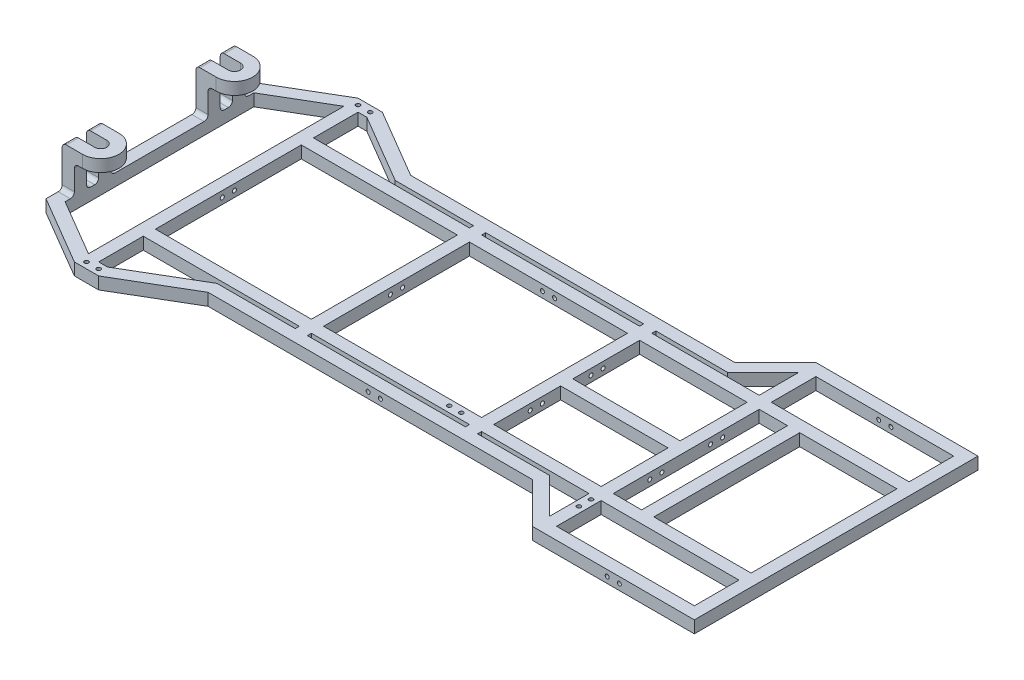
from build123d import *

# Parameters (mm, degrees)
SKETCH1_R               = 5
SKETCH1_W               = 340
SKETCH1_H               = 110
SKETCH1_W_2             = 390
SKETCH1_H_2             = 10
SKETCH1_W_3             = 70
SKETCH1_H_3             = 360
SKETCH1_W_4             = 385
SKETCH1_W_5             = 240
SKETCH1_W_6             = 265
SKETCH1_H_4             = 165
BOSS_EXTRUDE2_DEPTH     = 30
SKETCH2_R               = 5
CUT_EXTRUDE1_DEPTH      = 160
SKETCH3_R               = 5
CUT_EXTRUDE2_DEPTH      = 98
SKETCH4_R               = 5
CUT_EXTRUDE3_DEPTH      = 466
SKETCH5_R               = 5
CUT_EXTRUDE4_DEPTH      = 363
CUT_EXTRUDE5_DEPTH      = 1405.207961806
CUT_EXTRUDE5_DEPTH_BACK = 1405.207961806
SKETCH7_R               = 5
SKETCH9_W               = 30
SKETCH9_H               = 30
BOSS_EXTRUDE3_DEPTH     = 100
SKETCH10_W              = 30
SKETCH10_H              = 30
BOSS_EXTRUDE4_DEPTH     = 20
SKETCH11_W              = 30
SKETCH11_H              = 30
REVOLVE1_ANGLE          = 180
SKETCH14_W              = 30
SKETCH14_H              = 30
REVOLVE2_ANGLE          = 180
SKETCH15_W              = 30
SKETCH15_H              = 30
REVOLVE3_ANGLE          = 180
SKETCH16_W              = 30
SKETCH16_H              = 30
REVOLVE4_ANGLE          = 180
FILLET1_START           = -400
FILLET1_DEPTH           = 30
FILLET1_START_2         = 1270
FILLET1_2_DEPTH         = 30
FILLET1_START_3         = -210
FILLET1_3_DEPTH         = 30
FILLET1_START_4         = -150
FILLET1_4_DEPTH         = 30
FILLET1_START_5         = 120
FILLET1_5_DEPTH         = 30
FILLET1_START_6         = 180
FILLET1_6_DEPTH         = 30
FILLET1_7_DEPTH         = 420
SKETCH18_W              = 586.868745825
SKETCH18_H              = 161.669543438
CUT_EXTRUDE6_DEPTH      = 118
SKETCH19_R              = 5
CUT_EXTRUDE7_DEPTH      = 1351


with BuildPart() as part:
    # Sketch1 → Boss-Extrude2 (new body)
    with BuildSketch(Plane(origin=(0, 0, 0), x_dir=(1, 0, 0), z_dir=(0, 1, 0))):
        Polygon((-400, 0), (-400, 250), (-230, 350), (-170, 350), (0, 250), (800, 250), (900, 350), (1300, 350), (1300, 0), (1300, -350), (900, -350), (800, -250), (0, -250), (-170, -350), (-230, -350), (-400, -250), align=None)
        with Locations(Location((-185, -335, 0), (0, 0, 270))):
            Circle(SKETCH1_R, mode=Mode.SUBTRACT)
        with Locations(Location((-215, -335, 0), (0, 0, 270))):
            Circle(SKETCH1_R, mode=Mode.SUBTRACT)
        with Locations(Location((-185, 335, 0), (0, 0, 270))):
            Circle(SKETCH1_R, mode=Mode.SUBTRACT)
        with Locations(Location((-215, 335, 0), (0, 0, 270))):
            Circle(SKETCH1_R, mode=Mode.SUBTRACT)
        Polygon((-370, 15), (-370, 232.841618371), (-230, 315.194559547), (-230, 15), (-230, -15), (-230, -315.194559547), (-370, -232.841618371), (-370, -15), align=None, mode=Mode.SUBTRACT)
        Polygon((-200, 320), (-178.16924877, 320), (-8.16924877, 220), (185, 220), (185, 210), (-200, 210), align=None, mode=Mode.SUBTRACT)
        Polygon((812.426406871, 220), (900, 307.573593129), (900, 210), (635, 210), (635, 220), align=None, mode=Mode.SUBTRACT)
        with Locations((1100, 265)):
            Rectangle(SKETCH1_W, SKETCH1_H, mode=Mode.SUBTRACT)
        with Locations((410, 215)):
            Rectangle(SKETCH1_W_2, SKETCH1_H_2, mode=Mode.SUBTRACT)
        Polygon((900, -210), (900, -307.573593129), (812.426406871, -220), (635, -220), (635, -210), align=None, mode=Mode.SUBTRACT)
        with Locations((965, 0)):
            Rectangle(SKETCH1_W_3, SKETCH1_H_3, mode=Mode.SUBTRACT)
        with Locations((410, 0)):
            Rectangle(SKETCH1_W_2, SKETCH1_H_3, mode=Mode.SUBTRACT)
        with Locations((-7.5, 0)):
            Rectangle(SKETCH1_W_4, SKETCH1_H_3, mode=Mode.SUBTRACT)
        with Locations((1150, 0)):
            Rectangle(SKETCH1_W_5, SKETCH1_H_3, mode=Mode.SUBTRACT)
        with Locations((767.5, 97.5)):
            Rectangle(SKETCH1_W_6, SKETCH1_H_4, mode=Mode.SUBTRACT)
        with Locations((1100, -265)):
            Rectangle(SKETCH1_W, SKETCH1_H, mode=Mode.SUBTRACT)
        with Locations((767.5, -97.5)):
            Rectangle(SKETCH1_W_6, SKETCH1_H_4, mode=Mode.SUBTRACT)
        with Locations((410, -215)):
            Rectangle(SKETCH1_W_2, SKETCH1_H_2, mode=Mode.SUBTRACT)
        Polygon((-200, -210), (185, -210), (185, -220), (-8.16924877, -220), (-178.16924877, -320), (-200, -320), align=None, mode=Mode.SUBTRACT)
    extrude(amount=BOSS_EXTRUDE2_DEPTH)

    # Sketch2 → Cut-Extrude1 (cut)
    with BuildSketch(Plane.XY.offset(250)):
        with Locations(Location((1085, 15, 0), (0, 0, 180))):
            Circle(SKETCH2_R)
        with Locations(Location((1115, 15, 0), (0, 0, 180))):
            Circle(SKETCH2_R)
    extrude(amount=CUT_EXTRUDE1_DEPTH, mode=Mode.SUBTRACT)

    # Sketch3 → Cut-Extrude2 (cut)
    with BuildSketch(Plane(origin=(0, 0, -350), x_dir=(-1, 0, 0), z_dir=(0, 0, -1))):
        with Locations((-1085, 15)):
            Circle(SKETCH3_R)
        with Locations((-1115, 15)):
            Circle(SKETCH3_R)
    extrude(amount=-CUT_EXTRUDE2_DEPTH, mode=Mode.SUBTRACT)

    # Sketch4 → Cut-Extrude3 (cut)
    with BuildSketch(Plane(origin=(215, 0, 0), x_dir=(0, 0, -1), z_dir=(1, 0, 0))):
        with Locations((15, 15)):
            Circle(SKETCH4_R)
        with Locations((-15, 15)):
            Circle(SKETCH4_R)
    extrude(amount=-CUT_EXTRUDE3_DEPTH, mode=Mode.SUBTRACT)

    # Sketch5 → Cut-Extrude4 (cut)
    with BuildSketch(Plane.ZY.offset(-605)):
        with Locations((-90, 15)):
            Circle(SKETCH5_R)
        with Locations(Location((-60, 15, 0), (0, 0, 180))):
            Circle(SKETCH5_R)
        with Locations((60, 15)):
            Circle(SKETCH5_R)
        with Locations((90, 15)):
            Circle(SKETCH5_R)
    extrude(amount=-CUT_EXTRUDE4_DEPTH, mode=Mode.SUBTRACT)

    # Sketch7 → Cut-Extrude5 (cut, two sides: drawn at the far end of the back side and taken through both)
    with BuildSketch(Plane.XY.offset(-180).offset(-CUT_EXTRUDE5_DEPTH_BACK)):
        with Locations(Location((395, 15, 0), (0, 0, 180))):
            Circle(SKETCH7_R)
        with Locations(Location((425, 15, 0), (0, 0, 180))):
            Circle(SKETCH7_R)
    extrude(amount=CUT_EXTRUDE5_DEPTH + CUT_EXTRUDE5_DEPTH_BACK, mode=Mode.SUBTRACT)

    # Sketch9 → Boss-Extrude3 (add)
    with BuildSketch(Plane(origin=(0, 30, 0), x_dir=(1, 0, 0), z_dir=(0, 1, 0))):
        with Locations((-385, 195)):
            Rectangle(SKETCH9_W, SKETCH9_H)
        with Locations((-385, 135)):
            Rectangle(SKETCH9_W, SKETCH9_H)
        with Locations((1285, 195)):
            Rectangle(SKETCH9_W, SKETCH9_H)
        with Locations((1285, 135)):
            Rectangle(SKETCH9_W, SKETCH9_H)
        with Locations((1285, -195)):
            Rectangle(SKETCH9_W, SKETCH9_H)
        with Locations((1285, -135)):
            Rectangle(SKETCH9_W, SKETCH9_H)
        with Locations((-385, -195)):
            Rectangle(SKETCH9_W, SKETCH9_H)
        with Locations((-385, -135)):
            Rectangle(SKETCH9_W, SKETCH9_H)
    extrude(amount=BOSS_EXTRUDE3_DEPTH)

    # Sketch10 → Boss-Extrude4 (add)
    with BuildSketch(Plane(origin=(-370, 0, 0), x_dir=(0, 0, -1), z_dir=(1, 0, 0))):
        with Locations((195, 115)):
            Rectangle(SKETCH10_W, SKETCH10_H)
        with Locations((135, 115)):
            Rectangle(SKETCH10_W, SKETCH10_H)
        with Locations((-195, 115)):
            Rectangle(SKETCH10_W, SKETCH10_H)
        with Locations((-135, 115)):
            Rectangle(SKETCH10_W, SKETCH10_H)
    extrude(amount=BOSS_EXTRUDE4_DEPTH)

    # Sketch11 → Revolve1 (revolve)
    with BuildSketch(Plane(origin=(-350, 0, 0), x_dir=(0, 0, -1), z_dir=(1, 0, 0))):
        with Locations((135, 115)):
            Rectangle(SKETCH11_W, SKETCH11_H)
    revolve(axis=Axis((-350, 100, -165), (0, 1, 0)), revolution_arc=REVOLVE1_ANGLE)

    # Sketch14 → Revolve2 (revolve)
    with BuildSketch(Plane(origin=(-350, 0, 0), x_dir=(0, 0, -1), z_dir=(1, 0, 0))):
        with Locations((-195, 115)):
            Rectangle(SKETCH14_W, SKETCH14_H)
    revolve(axis=Axis((-350, 100, 165), (0, 1, 0)), revolution_arc=REVOLVE2_ANGLE)

    # Sketch15 → Revolve3 (revolve)
    with BuildSketch(Plane(origin=(0, 130, 0), x_dir=(1, 0, 0), z_dir=(0, 1, 0))):
        with Locations((1285, -195)):
            Rectangle(SKETCH15_W, SKETCH15_H)
    revolve(axis=Axis((1270, 130, 165), (-1, 0, 0)), revolution_arc=REVOLVE3_ANGLE)

    # Sketch16 → Revolve4 (revolve)
    with BuildSketch(Plane(origin=(0, 130, 0), x_dir=(1, 0, 0), z_dir=(0, 1, 0))):
        with Locations((1285, 135)):
            Rectangle(SKETCH16_W, SKETCH16_H)
    revolve(axis=Axis((1270, 130, -165), (-1, 0, 0)), revolution_arc=REVOLVE4_ANGLE)

    # Fillet1: read off the stored shape, not the designer's step
    # Fillet1 outline → Fillet1 (add)
    with BuildSketch(Plane.YZ.offset(FILLET1_START)):
        with BuildLine():
            ThreePointArc((40, -180), (32.928932188, -177.071067812), (30, -170))
            Line((30, -170), (30, -180))
            Line((30, -180), (40, -180))
        make_face()
        with BuildLine():
            Line((30, 120), (30, 110))
            ThreePointArc((30, 110), (32.928932188, 117.071067812), (40, 120))
            Line((40, 120), (30, 120))
        make_face()
        with BuildLine():
            Line((30, -150), (30, -160))
            ThreePointArc((30, -160), (32.928932188, -152.928932188), (40, -150))
            Line((40, -150), (30, -150))
        make_face()
        with BuildLine():
            Line((40, -210), (30, -210))
            Line((30, -210), (30, -220))
            ThreePointArc((30, -220), (32.928932188, -212.928932188), (40, -210))
        make_face()
        with BuildLine():
            Line((30, -110), (30, -120))
            Line((30, -120), (40, -120))
            ThreePointArc((40, -120), (32.928932188, -117.071067812), (30, -110))
        make_face()
        with BuildLine():
            Line((30, 160), (30, 150))
            Line((30, 150), (40, 150))
            ThreePointArc((40, 150), (32.928932188, 152.928932188), (30, 160))
        make_face()
        with BuildLine():
            Line((30, 180), (30, 170))
            ThreePointArc((30, 170), (32.928932188, 177.071067812), (40, 180))
            Line((40, 180), (30, 180))
        make_face()
        with BuildLine():
            Line((30, 210), (40, 210))
            ThreePointArc((40, 210), (32.928932188, 212.928932188), (30, 220))
            Line((30, 220), (30, 210))
        make_face()
    extrude(amount=FILLET1_DEPTH)

    # Fillet1 2 outline → Fillet1 2 (add)
    with BuildSketch(Plane.YZ.offset(FILLET1_START_2)):
        with BuildLine():
            ThreePointArc((40, -180), (32.928932188, -177.071067812), (30, -170))
            Line((30, -170), (30, -180))
            Line((30, -180), (40, -180))
        make_face()
        with BuildLine():
            Line((30, 120), (30, 110))
            ThreePointArc((30, 110), (32.928932188, 117.071067812), (40, 120))
            Line((40, 120), (30, 120))
        make_face()
        with BuildLine():
            Line((30, -150), (30, -160))
            ThreePointArc((30, -160), (32.928932188, -152.928932188), (40, -150))
            Line((40, -150), (30, -150))
        make_face()
        with BuildLine():
            Line((40, -210), (30, -210))
            Line((30, -210), (30, -220))
            ThreePointArc((30, -220), (32.928932188, -212.928932188), (40, -210))
        make_face()
        with BuildLine():
            Line((30, -110), (30, -120))
            Line((30, -120), (40, -120))
            ThreePointArc((40, -120), (32.928932188, -117.071067812), (30, -110))
        make_face()
        with BuildLine():
            Line((30, 160), (30, 150))
            Line((30, 150), (40, 150))
            ThreePointArc((40, 150), (32.928932188, 152.928932188), (30, 160))
        make_face()
        with BuildLine():
            Line((30, 180), (30, 170))
            ThreePointArc((30, 170), (32.928932188, 177.071067812), (40, 180))
            Line((40, 180), (30, 180))
        make_face()
        with BuildLine():
            Line((30, 210), (40, 210))
            ThreePointArc((40, 210), (32.928932188, 212.928932188), (30, 220))
            Line((30, 220), (30, 210))
        make_face()
    extrude(amount=FILLET1_2_DEPTH)

    # Fillet1 3 outline → Fillet1 3 (add)
    with BuildSketch(Plane.XY.offset(FILLET1_START_3)):
        with BuildLine():
            Line((-370, 100), (-370, 90))
            ThreePointArc((-370, 90), (-367.071067812, 97.071067812), (-360, 100))
            Line((-360, 100), (-370, 100))
        make_face()
    extrude(amount=FILLET1_3_DEPTH)

    # Fillet1 4 outline → Fillet1 4 (add)
    with BuildSketch(Plane.XY.offset(FILLET1_START_4)):
        with BuildLine():
            Line((-370, 100), (-370, 90))
            ThreePointArc((-370, 90), (-367.071067812, 97.071067812), (-360, 100))
            Line((-360, 100), (-370, 100))
        make_face()
    extrude(amount=FILLET1_4_DEPTH)

    # Fillet1 5 outline → Fillet1 5 (add)
    with BuildSketch(Plane.XY.offset(FILLET1_START_5)):
        with BuildLine():
            Line((-370, 100), (-370, 90))
            ThreePointArc((-370, 90), (-367.071067812, 97.071067812), (-360, 100))
            Line((-360, 100), (-370, 100))
        make_face()
    extrude(amount=FILLET1_5_DEPTH)

    # Fillet1 6 outline → Fillet1 6 (add)
    with BuildSketch(Plane.XY.offset(FILLET1_START_6)):
        with BuildLine():
            Line((-370, 100), (-370, 90))
            ThreePointArc((-370, 90), (-367.071067812, 97.071067812), (-360, 100))
            Line((-360, 100), (-370, 100))
        make_face()
    extrude(amount=FILLET1_6_DEPTH)

    # Fillet1 7 outline → Fillet1 7 (cut)
    with BuildSketch(Plane.XY.offset(FILLET1_START_3)):
        with BuildLine():
            Line((-400, 130), (-400, 120))
            ThreePointArc((-400, 120), (-397.071067812, 127.071067812), (-390, 130))
            Line((-390, 130), (-400, 130))
        make_face()
    extrude(amount=FILLET1_7_DEPTH, mode=Mode.SUBTRACT)

    # Sketch18 → Cut-Extrude6 (cut)
    with BuildSketch(Plane(origin=(1300, 0, 0), x_dir=(0, 0, -1), z_dir=(1, 0, 0))):
        with Locations((-14.139220217, 110.834771719)):
            Rectangle(SKETCH18_W, SKETCH18_H)
    extrude(amount=-CUT_EXTRUDE6_DEPTH, mode=Mode.SUBTRACT)

    # Sketch19 → Cut-Extrude7 (cut, through all)
    with BuildSketch(Plane(origin=(0, 30, 0), x_dir=(1, 0, 0), z_dir=(0, 1, 0))):
        with Locations(Location((915, -220, 0), (0, 0, 270))):
            Circle(SKETCH19_R)
        with Locations(Location((915, -250, 0), (0, 0, 90))):
            Circle(SKETCH19_R)
        with Locations(Location((570, -195, 0), (0, 0, 270))):
            Circle(SKETCH19_R)
        with Locations(Location((540, -195, 0), (0, 0, 90))):
            Circle(SKETCH19_R)
    extrude(amount=-CUT_EXTRUDE7_DEPTH, mode=Mode.SUBTRACT)


solid = part.part
